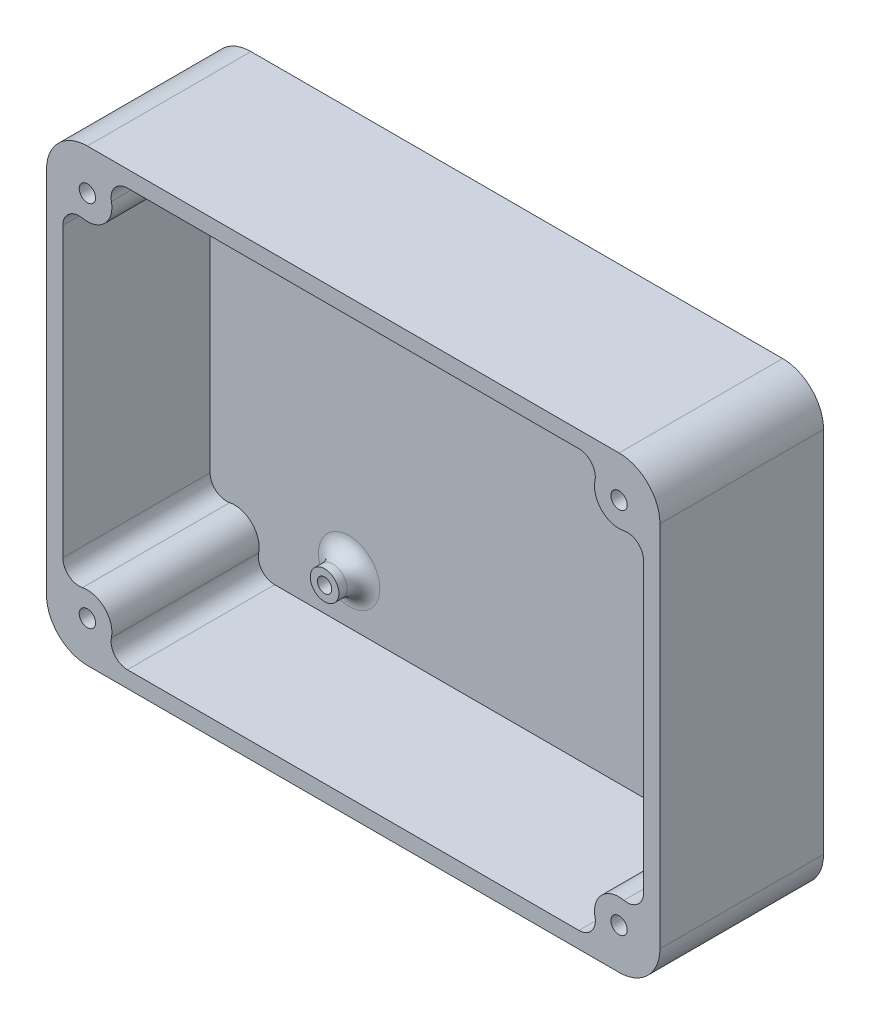
from build123d import *

# Parameters (mm, degrees)
BOSS_EXTRUDE1_DEPTH = 4
SKETCH1_3_R         = 2
BOSS_EXTRUDE4_DEPTH = 40
FILLET3_R           = 4
SKETCH4_R           = 3.5
SKETCH4_R_2         = 1.75
BOSS_EXTRUDE5_DEPTH = 6
FILLET2_R           = 4


with BuildPart() as part:
    # Sketch1 → Boss-Extrude1 (new body)
    with BuildSketch(Plane.XY):
        with BuildLine():
            ThreePointArc((16, 10), (14.242640687, 5.757359313), (10, 4))
            Line((10, 4), (140, 4))
            ThreePointArc((140, 4), (135.757359313, 14.242640687), (146, 10))
            Line((146, 10), (146, 100))
            ThreePointArc((146, 100), (135.757359313, 95.757359313), (140, 106))
            Line((140, 106), (10, 106))
            ThreePointArc((10, 106), (14.242640687, 104.242640687), (16, 100))
            ThreePointArc((16, 100), (10, 94), (4, 100))
            Line((4, 100), (4, 10))
            ThreePointArc((4, 10), (10, 16), (16, 10))
        make_face()
    extrude(amount=BOSS_EXTRUDE1_DEPTH)

    # Sketch1<3> → Boss-Extrude4 (add)
    with BuildSketch(Plane.XY):
        with BuildLine():
            ThreePointArc((0, 10), (2.928932188, 2.928932188), (10, 0))
            Line((10, 0), (140, 0))
            ThreePointArc((140, 0), (147.071067812, 2.928932188), (150, 10))
            Line((150, 10), (150, 100))
            ThreePointArc((150, 100), (147.071067812, 107.071067812), (140, 110))
            Line((140, 110), (10, 110))
            ThreePointArc((10, 110), (2.928932188, 107.071067812), (0, 100))
            Line((0, 100), (0, 10))
        make_face()
        with BuildLine():
            Line((140, 4), (10, 4))
            ThreePointArc((10, 4), (14.242640687, 14.242640687), (4, 10))
            Line((4, 10), (4, 100))
            ThreePointArc((4, 100), (14.242640687, 95.757359313), (10, 106))
            Line((10, 106), (140, 106))
            ThreePointArc((140, 106), (135.757359313, 95.757359313), (146, 100))
            Line((146, 100), (146, 10))
            ThreePointArc((146, 10), (135.757359313, 14.242640687), (140, 4))
        make_face(mode=Mode.SUBTRACT)
        with Locations((10, 10)):
            Circle(SKETCH1_3_R, mode=Mode.SUBTRACT)
        with Locations((140, 10)):
            Circle(SKETCH1_3_R, mode=Mode.SUBTRACT)
        with Locations((10, 100)):
            Circle(SKETCH1_3_R, mode=Mode.SUBTRACT)
        with Locations((140, 100)):
            Circle(SKETCH1_3_R, mode=Mode.SUBTRACT)
    extrude(amount=BOSS_EXTRUDE4_DEPTH)

    # Fillet3
    fillet3_edges = [part.edges().sort_by_distance(p)[0] for p in [
        (140, 4, 22),
    ]]
    fillet(fillet3_edges, radius=FILLET3_R)
    fillet3_2_edges = [part.edges().sort_by_distance(p)[0] for p in [
        (4, 100, 22),
        (10, 106, 22),
        (140, 106, 22),
        (146, 100, 22),
        (146, 10, 22),
        (10, 4, 22),
        (4, 10, 22),
    ]]
    fillet(fillet3_2_edges, radius=FILLET3_R)

    # Sketch4 → Boss-Extrude5 (add)
    # profile 1 of 4: a face of its own
    with BuildSketch(Plane.XY.offset(4)):
        with Locations((38, 100)):
            Circle(SKETCH4_R)
        with Locations((38, 100)):
            Circle(SKETCH4_R_2, mode=Mode.SUBTRACT)
    # profile 2 of 4: a face of its own
    with BuildSketch(Plane.XY.offset(4)):
        with Locations((38, 16)):
            Circle(SKETCH4_R)
        with Locations((38, 16)):
            Circle(SKETCH4_R_2, mode=Mode.SUBTRACT)
    # profile 3 of 4: a face of its own
    with BuildSketch(Plane.XY.offset(4)):
        with Locations((125, 16)):
            Circle(SKETCH4_R)
        with Locations((125, 16)):
            Circle(SKETCH4_R_2, mode=Mode.SUBTRACT)
    # profile 4 of 4: a face of its own
    with BuildSketch(Plane.XY.offset(4)):
        with Locations((125, 100)):
            Circle(SKETCH4_R)
        with Locations((125, 100)):
            Circle(SKETCH4_R_2, mode=Mode.SUBTRACT)
    extrude(amount=BOSS_EXTRUDE5_DEPTH)

    # Fillet2
    # the kernel refuses this fillet: 4 mm, written as the material it adds along each edge
    with BuildSketch(Plane(origin=(38, 100, 4), x_dir=(1, 0, 0), z_dir=(0, -1, 0))) as fillet2_piece_1:
        with BuildLine():
            CenterArc((3.5 + FILLET2_R, FILLET2_R), FILLET2_R, 180, 90)
            Line((3.5, FILLET2_R), (3.5, 0))
            Line((3.5, 0), (3.5 + FILLET2_R, 0))
        make_face()
    revolve(axis=Axis((38, 100, 4), (0, 0, 1)))
    with BuildSketch(Plane(origin=(38, 16, 4), x_dir=(1, 0, 0), z_dir=(0, -1, 0))) as fillet2_piece_2:
        with BuildLine():
            CenterArc((3.5 + FILLET2_R, FILLET2_R), FILLET2_R, 180, 90)
            Line((3.5, FILLET2_R), (3.5, 0))
            Line((3.5, 0), (3.5 + FILLET2_R, 0))
        make_face()
    revolve(axis=Axis((38, 16, 4), (0, 0, 1)))
    with BuildSketch(Plane(origin=(125, 16, 4), x_dir=(1, 0, 0), z_dir=(0, -1, 0))) as fillet2_piece_3:
        with BuildLine():
            CenterArc((3.5 + FILLET2_R, FILLET2_R), FILLET2_R, 180, 90)
            Line((3.5, FILLET2_R), (3.5, 0))
            Line((3.5, 0), (3.5 + FILLET2_R, 0))
        make_face()
    revolve(axis=Axis((125, 16, 4), (0, 0, 1)))
    with BuildSketch(Plane(origin=(125, 100, 4), x_dir=(1, 0, 0), z_dir=(0, -1, 0))) as fillet2_piece_4:
        with BuildLine():
            CenterArc((3.5 + FILLET2_R, FILLET2_R), FILLET2_R, 180, 90)
            Line((3.5, FILLET2_R), (3.5, 0))
            Line((3.5, 0), (3.5 + FILLET2_R, 0))
        make_face()
    revolve(axis=Axis((125, 100, 4), (0, 0, 1)))


solid = part.part
